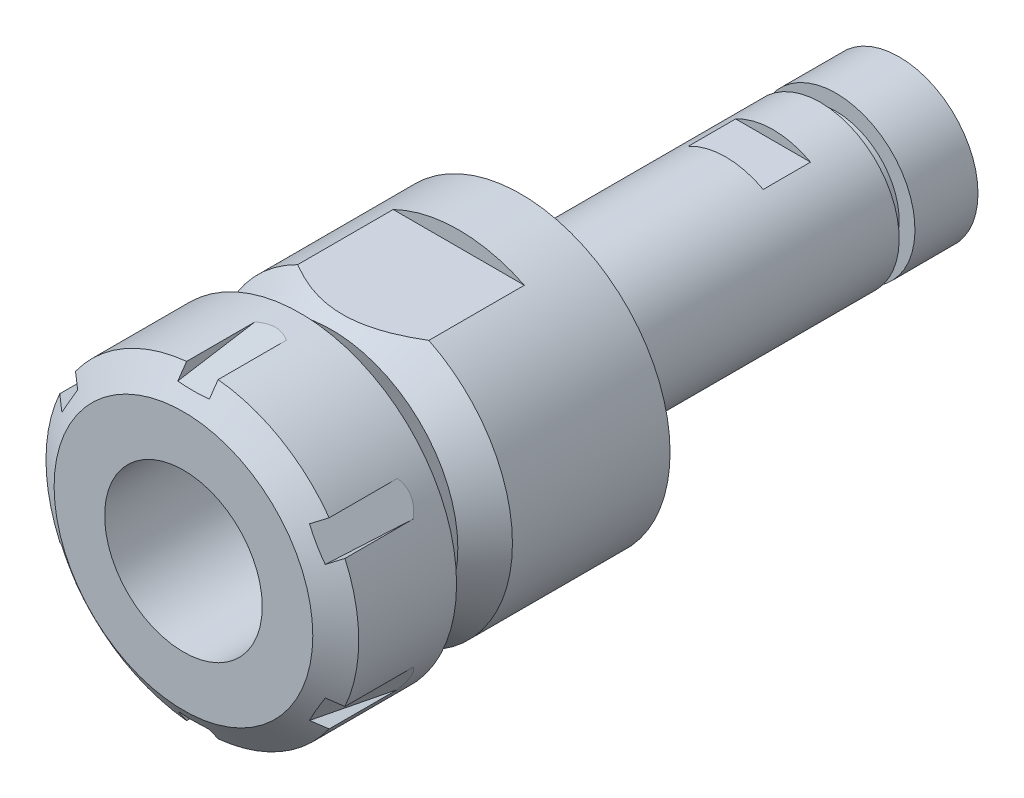
from build123d import *

# Parameters (mm, degrees)
SKETCH1_R               = 15.875
BOSS_EXTRUDE1_DEPTH     = 101.6
SKETCH2_R               = 30.0482
BOSS_EXTRUDE2_DEPTH     = 31.75
SKETCH6_R               = 31.496
BOSS_EXTRUDE3_DEPTH     = 23.5204
FILLET1_R               = 2.54
SKETCH7_R               = 6.35
CUT_EXTRUDE1_DEPTH      = 169.5704
CUT_EXTRUDE2_START      = -36.2204
SKETCH8_R               = 15.875
CUT_EXTRUDE2_DEPTH      = 36.2204
CUT_EXTRUDE3_DEPTH      = 54.102
CUT_EXTRUDE3_DEPTH_BACK = 48.26
CHAMFER1_SIZE           = 3.81
CHAMFER1_SIZE2          = 5.441243906
CUT_EXTRUDE4_DEPTH      = 3.175
CIRPATTERN1_COUNT       = 6
SKETCH11_W              = 31.75
SKETCH11_H              = 25.4
CUT_EXTRUDE5_DEPTH      = 97.536
SKETCH12_R              = 19.151691295
SKETCH12_R_2            = 12.7
CUT_EXTRUDE6_DEPTH      = 3.175
CUT_EXTRUDE7_DEPTH      = 9.525


with BuildPart() as part:
    # Sketch1 → Boss-Extrude1 (new body)
    with BuildSketch(Plane.XY):
        Circle(SKETCH1_R)
    extrude(amount=BOSS_EXTRUDE1_DEPTH)

    # Sketch2 → Boss-Extrude2 (add)
    with BuildSketch(Plane.XY.offset(101.6)):
        Circle(SKETCH2_R)
    extrude(amount=BOSS_EXTRUDE2_DEPTH)

    # Sketch5 → Revolve1 (revolve)
    with BuildSketch(Plane(origin=(0, 0, 0), x_dir=(0, 0, -1), z_dir=(1, 0, 0))):
        Polygon((-133.35, 30.0482), (-139.7, 25.4), (-146.05, 30.0482), (-146.05, 0), (-133.35, 0), align=None)
    revolve(axis=Axis((0, 0, 146.05), (0, 0, -1)))

    # Sketch6 → Boss-Extrude3 (add)
    with BuildSketch(Plane.XY.offset(146.05)):
        Circle(SKETCH6_R)
    extrude(amount=BOSS_EXTRUDE3_DEPTH)

    # Fillet1
    fillet1_edges = [part.edges().sort_by_distance(p)[0] for p in [
        (-15.875, 0, 0),
    ]]
    fillet(fillet1_edges, radius=FILLET1_R)

    # Sketch7 → Cut-Extrude1 (cut)
    with BuildSketch(Plane(origin=(0, 0, 0), x_dir=(-1, 0, 0), z_dir=(0, 0, -1))):
        Circle(SKETCH7_R)
    extrude(amount=-CUT_EXTRUDE1_DEPTH, mode=Mode.SUBTRACT)

    # Sketch8 → Cut-Extrude2 (cut)
    with BuildSketch(Plane.XY.offset(169.5704).offset(CUT_EXTRUDE2_START)):
        Circle(SKETCH8_R)
    extrude(amount=CUT_EXTRUDE2_DEPTH, mode=Mode.SUBTRACT)

    # Sketch9 → Cut-Extrude3 (cut, two sides: drawn at the far end of the back side and taken through both)
    with BuildSketch(Plane(origin=(0, 0, 0), x_dir=(0, 0, -1), z_dir=(1, 0, 0)).offset(-CUT_EXTRUDE3_DEPTH_BACK)):
        Polygon((-114.116493623, 26.9875), (-114.116493623, 30.0482), (-133.35, 30.0482), (-137.531284153, 26.9875), align=None)
        Polygon((-114.116493623, -30.0482), (-114.116493623, -26.9875), (-137.531284153, -26.9875), (-133.35, -30.0482), align=None)
    extrude(amount=CUT_EXTRUDE3_DEPTH + CUT_EXTRUDE3_DEPTH_BACK, mode=Mode.SUBTRACT)

    # Chamfer1
    chamfer1_edges = [part.edges().sort_by_distance(p)[0] for p in [
        (-31.496, 0, 169.5704),
    ]]
    chamfer1_side = [part.faces().sort_by_distance(p)[0] for p in [
        (-31.496, 0, 157.8102),
    ]]
    chamfer(chamfer1_edges, length=CHAMFER1_SIZE, length2=CHAMFER1_SIZE2, reference=chamfer1_side[0])

    # Sketch10 → Cut-Extrude4 (cut, symmetric)
    with BuildSketch(Plane(origin=(0, 0, 0), x_dir=(0, 0, -1), z_dir=(1, 0, 0))):
        Polygon((-151.026387813, 31.496), (-167.6654, 28.775378047), (-167.6654, 34.719485934), align=None)
    cut_extrude4 = extrude(amount=CUT_EXTRUDE4_DEPTH, both=True, mode=Mode.SUBTRACT)

    # CirPattern1: Cut-Extrude4 ×6 about axis
    cirpattern1_axis = Axis((0, 0, 169.5704), (0, 0, 1))
    for i in range(1, CIRPATTERN1_COUNT):
        add(cut_extrude4.rotate(cirpattern1_axis, i * 360 / CIRPATTERN1_COUNT), mode=Mode.SUBTRACT)

    # Sketch11 → Cut-Extrude5 (cut)
    with BuildSketch(Plane(origin=(0, 26.9875, 0), x_dir=(1, 0, 0), z_dir=(0, 1, 0))):
        with Locations((0, -12.7)):
            Rectangle(SKETCH11_W, SKETCH11_H)
    extrude(amount=-CUT_EXTRUDE5_DEPTH, mode=Mode.SUBTRACT)

    # Sketch12 → Cut-Extrude6 (cut)
    with BuildSketch(Plane(origin=(0, 0, 38.1), x_dir=(-1, 0, 0), z_dir=(0, 0, -1))):
        Circle(SKETCH12_R)
        Circle(SKETCH12_R_2, mode=Mode.SUBTRACT)
    extrude(amount=-CUT_EXTRUDE6_DEPTH, mode=Mode.SUBTRACT)

    # Sketch13 → Cut-Extrude7 (cut)
    with BuildSketch(Plane(origin=(0, 0, 50.8), x_dir=(-1, 0, 0), z_dir=(0, 0, -1))):
        with BuildLine():
            Line((-7.540207225, 13.97), (0, 13.97))
            Line((0, 13.97), (7.540207225, 13.97))
            ThreePointArc((7.540207225, 13.97), (0, 15.875), (-7.540207225, 13.97))
        make_face()
    extrude(amount=-CUT_EXTRUDE7_DEPTH, mode=Mode.SUBTRACT)


solid = part.part
